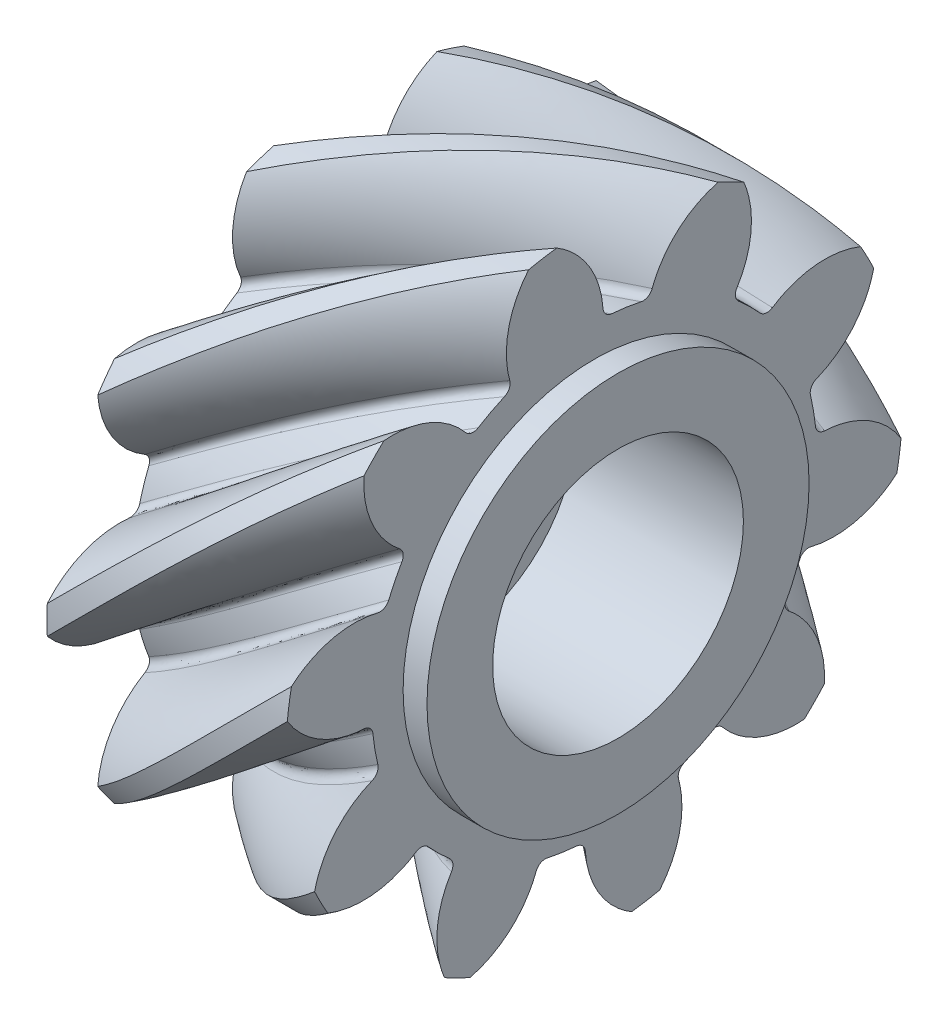
from build123d import *

# Parameters (mm, degrees)
BASPROSKE_W            = 5
BASPROSKE_H            = 6.456854249
TOOTHCUTLH_PITCH       = 40.569611751
TOOTHCUTLH_HEIGHT      = 5
TOOTHCUTLH_RADIUS      = 6.456854249
TOOTHCUTLH_START_ANGLE = -90
TEETHCUTSLH_COUNT      = 10
TEETHCUTSLH_ANGLE      = 324
SKETCH4_R              = 4
BOSS_EXTRUDE1_DEPTH    = 0.5
BORE_START             = 2
BORSKE_R               = 2.625
BORE_DEPTH             = 3.5
SKETCH5_R              = 1.25
CUT_EXTRUDE1_DEPTH     = 2


with BuildPart() as part:
    # BasProSke → Base-Revolve (revolve)
    with BuildSketch(Plane(origin=(0, 0, 0), x_dir=(1, 0, 0), z_dir=(0, 1, 0)), mode=Mode.PRIVATE) as base_revolve_sk:
        with Locations((2.5, 3.228427125)):
            Rectangle(BASPROSKE_W, BASPROSKE_H)
    revolve(base_revolve_sk.sketch.rotate(Axis((-10, 0, 0), (1, 0, 0)), 180), axis=Axis((-10, 0, 0), (1, 0, 0)))

    # ToothCutLH: sweep along a helix
    with BuildLine() as toothcutlh_path:
        add(Helix(TOOTHCUTLH_PITCH, TOOTHCUTLH_HEIGHT, TOOTHCUTLH_RADIUS, center=(0, 0, 0), direction=(1, 0, 0), lefthand=True, mode=Mode.PRIVATE).rotate(Axis((0, 0, 0), (1, 0, 0)), TOOTHCUTLH_START_ANGLE))
    # TooCutSkeRH<3> → ToothCutLH (sweep, cut)
    with BuildSketch(Plane(origin=(0, 0, 0), x_dir=(0, 0, -1), z_dir=(1, 0, 0))):
        with BuildLine():
            ThreePointArc((0.310499314, 4.64649133), (0, 4.656854249), (-0.310499314, 4.64649133))
            ThreePointArc((-0.310499314, 4.64649133), (-0.444718542, 4.686407323), (-0.520300653, 4.80428621))
            ThreePointArc((-0.520300653, 4.80428621), (-1.056297591, 5.789023791), (-2.03797267, 6.330609297))
            ThreePointArc((-2.03797267, 6.330609297), (0, 6.650559877), (2.03797267, 6.330609297))
            ThreePointArc((2.03797267, 6.330609297), (1.056297591, 5.789023791), (0.520300653, 4.80428621))
            ThreePointArc((0.520300653, 4.80428621), (0.444718542, 4.686407323), (0.310499314, 4.64649133))
        make_face()
    toothcutlh = sweep(path=toothcutlh_path.line, is_frenet=True, mode=Mode.SUBTRACT)

    # TeethCutsLH: ToothCutLH ×10 about axis
    teethcutslh_axis = Axis((-10, 0, 0), (1, 0, 0))
    for i in range(1, TEETHCUTSLH_COUNT):
        add(toothcutlh.rotate(teethcutslh_axis, i * TEETHCUTSLH_ANGLE / (TEETHCUTSLH_COUNT - 1)), mode=Mode.SUBTRACT)

    # Sketch4 → Boss-Extrude1 (add)
    with BuildSketch(Plane(origin=(5, 0, 0), x_dir=(0, 0, -1), z_dir=(1, 0, 0))):
        with Locations(Location((0, 0, 0), (0, 0, 180))):
            Circle(SKETCH4_R)
    extrude(amount=BOSS_EXTRUDE1_DEPTH)

    # BorSke → Bore (cut)
    with BuildSketch(Plane(origin=(0, 0, 0), x_dir=(0, 0, -1), z_dir=(1, 0, 0)).offset(BORE_START)):
        Circle(BORSKE_R)
    extrude(amount=BORE_DEPTH, mode=Mode.SUBTRACT)

    # Sketch5 → Cut-Extrude1 (cut)
    with BuildSketch(Plane(origin=(2, 0, 0), x_dir=(0, 0, -1), z_dir=(1, 0, 0))):
        Circle(SKETCH5_R)
    extrude(amount=-CUT_EXTRUDE1_DEPTH, mode=Mode.SUBTRACT)


solid = part.part
